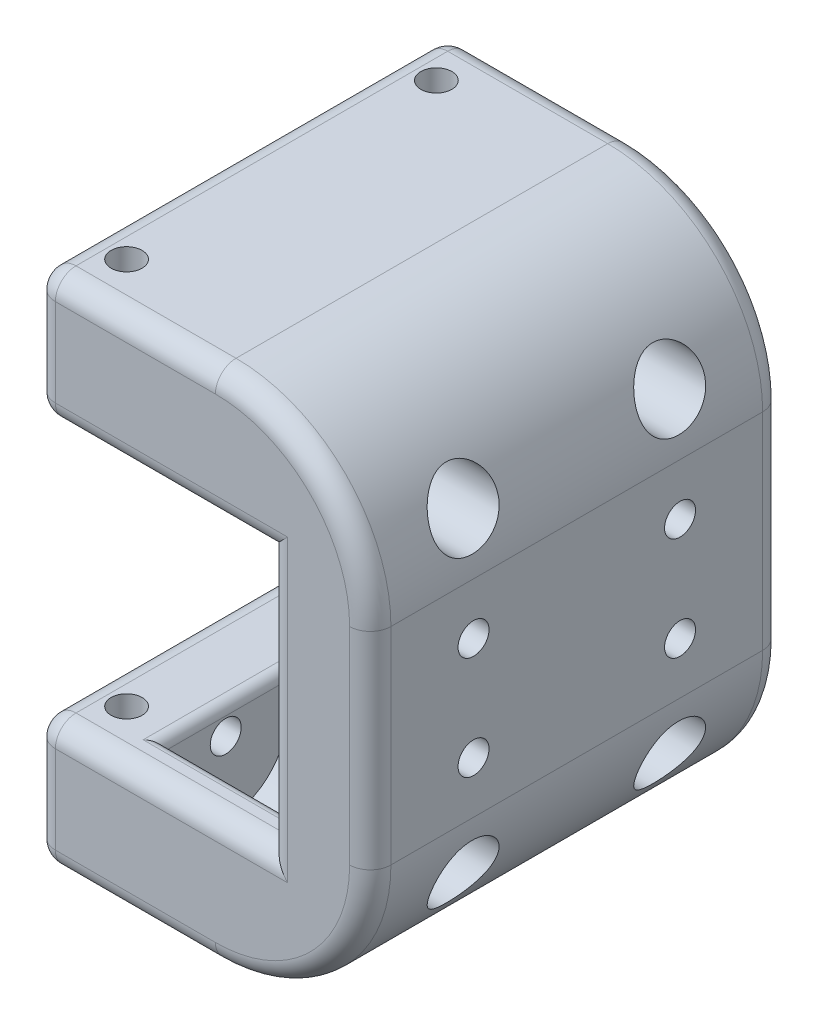
from build123d import *

# Parameters (mm, degrees)
BOSS_EXTRUDE1_DEPTH     = 50.8
SKETCH2_R               = 1.905
CUT_EXTRUDE1_DEPTH      = 92.194932014
CUT_EXTRUDE2_DEPTH      = 15.24
CUT_EXTRUDE3_START      = -92.194932014
SKETCH7_R               = 2.286
CUT_EXTRUDE3_DEPTH      = 107.434932014
CUT_EXTRUDE4_START      = -9.525
SKETCH8_R               = 4.1275
CUT_EXTRUDE4_DEPTH      = 101.719932014
SKETCH12_R              = 1.905
CUT_EXTRUDE8_DEPTH      = 9.525
SKETCH13_R              = 1.905
CUT_EXTRUDE9_DEPTH      = 9.525
SKETCH14_R              = 1.905
CUT_EXTRUDE10_DEPTH     = 10.795
MIRROR4_COPY_1_DEPTH    = 15.24
MIRROR4_START           = -92.194932014
MIRROR4_COPY_2_SKETCH_R = 2.286
MIRROR4_COPY_2_DEPTH    = 107.434932014
MIRROR4_START_2         = -9.525
MIRROR4_COPY_3_SKETCH_R = 4.1275
MIRROR4_COPY_3_DEPTH    = 101.719932014
MIRROR4_COPY_4_SKETCH_R = 1.905
MIRROR4_COPY_4_DEPTH    = 9.525
MIRROR4_COPY_5_SKETCH_R = 1.905
MIRROR4_COPY_5_DEPTH    = 9.525
MIRROR4_COPY_6_SKETCH_R = 1.905
MIRROR4_COPY_6_DEPTH    = 10.795
MIRROR4_COPY_7_SKETCH_R = 1.905
MIRROR4_COPY_7_DEPTH    = 9.525
FILLET3_DEPTH           = 50.8
FILLET4_R               = 2.54
FILLET5_R               = 1.27


with BuildPart() as part:
    # Sketch1 → Boss-Extrude1 (new body)
    with BuildSketch(Plane.XY):
        Polygon((0, 0), (0, 63.5), (-41.275, 63.5), (-41.275, 47.625), (-12.7, 47.625), (-12.7, 15.875), (-41.275, 15.875), (-41.275, 0), align=None)
    extrude(amount=BOSS_EXTRUDE1_DEPTH)

    # Sketch2 → Cut-Extrude1 (cut, through all)
    with BuildSketch(Plane(origin=(0, 63.5, 0), x_dir=(1, 0, 0), z_dir=(0, 1, 0))):
        with Locations(Location((-36.322, -44.45, 0), (0, 0, 180))):
            Circle(SKETCH2_R)
        with Locations(Location((-36.322, -6.35, 0), (0, 0, 180))):
            Circle(SKETCH2_R)
    extrude(amount=-CUT_EXTRUDE1_DEPTH, mode=Mode.SUBTRACT)

    # Sketch5 → Cut-Extrude2 (cut)
    with BuildSketch(Plane.ZY.offset(15.24)):
        with BuildLine():
            Line((5.08, 11.1125), (5.08, 15.875))
            Line((5.08, 15.875), (20.32, 15.875))
            Line((20.32, 15.875), (20.32, 11.1125))
            ThreePointArc((20.32, 11.1125), (12.7, 3.4925), (5.08, 11.1125))
        make_face()
    cut_extrude2 = extrude(amount=CUT_EXTRUDE2_DEPTH, mode=Mode.SUBTRACT)

    # Sketch7 → Cut-Extrude3 (cut)
    with BuildSketch(Plane.ZY.offset(CUT_EXTRUDE3_START)):
        with Locations(Location((12.7, 12.3825, 0), (0, 0, 180))):
            Circle(SKETCH7_R)
    cut_extrude3 = extrude(amount=CUT_EXTRUDE3_DEPTH, mode=Mode.SUBTRACT)

    # Sketch8 → Cut-Extrude4 (cut)
    with BuildSketch(Plane(origin=(0, 0, 0), x_dir=(0, 0, -1), z_dir=(1, 0, 0)).offset(CUT_EXTRUDE4_START)):
        with Locations(Location((-12.7, 12.3825, 0), (0, 0, 180))):
            Circle(SKETCH8_R)
    cut_extrude4 = extrude(amount=CUT_EXTRUDE4_DEPTH, mode=Mode.SUBTRACT)

    # Sketch12 → Cut-Extrude8 (cut)
    with BuildSketch(Plane(origin=(0, 0, 0), x_dir=(0, 0, -1), z_dir=(1, 0, 0))):
        with Locations((-12.7, 25.4)):
            Circle(SKETCH12_R)
    cut_extrude8 = extrude(amount=-CUT_EXTRUDE8_DEPTH, mode=Mode.SUBTRACT)

    # Sketch13 → Cut-Extrude9 (cut)
    with BuildSketch(Plane.ZY.offset(12.7)):
        with Locations((6.35, 31.75)):
            Circle(SKETCH13_R)
    cut_extrude9 = extrude(amount=-CUT_EXTRUDE9_DEPTH, mode=Mode.SUBTRACT)

    # Sketch14 → Cut-Extrude10 (cut)
    with BuildSketch(Plane.ZY.offset(41.275)):
        with Locations((12.7, 12.446)):
            Circle(SKETCH14_R)
    cut_extrude10 = extrude(amount=-CUT_EXTRUDE10_DEPTH, mode=Mode.SUBTRACT)

    # Mirror3: Cut-Extrude2, Cut-Extrude3, Cut-Extrude4, Cut-Extrude8, Cut-Extrude9, Cut-Extrude10 across plane
    add(cut_extrude2.mirror(Plane(origin=(0, 0, 25.4), x_dir=(1, 0, 0), z_dir=(0, 0, -1))), mode=Mode.SUBTRACT)
    add(cut_extrude3.mirror(Plane(origin=(0, 0, 25.4), x_dir=(1, 0, 0), z_dir=(0, 0, -1))), mode=Mode.SUBTRACT)
    add(cut_extrude4.mirror(Plane(origin=(0, 0, 25.4), x_dir=(1, 0, 0), z_dir=(0, 0, -1))), mode=Mode.SUBTRACT)
    add(cut_extrude8.mirror(Plane(origin=(0, 0, 25.4), x_dir=(1, 0, 0), z_dir=(0, 0, -1))), mode=Mode.SUBTRACT)
    add(cut_extrude9.mirror(Plane(origin=(0, 0, 25.4), x_dir=(1, 0, 0), z_dir=(0, 0, -1))), mode=Mode.SUBTRACT)
    add(cut_extrude10.mirror(Plane(origin=(0, 0, 25.4), x_dir=(1, 0, 0), z_dir=(0, 0, -1))), mode=Mode.SUBTRACT)

    # Mirror4: Cut-Extrude2, Cut-Extrude3, Cut-Extrude4, Cut-Extrude8, Cut-Extrude10 across plane
    add(cut_extrude2.mirror(Plane.ZX.offset(31.75)), mode=Mode.SUBTRACT)
    add(cut_extrude3.mirror(Plane.ZX.offset(31.75)), mode=Mode.SUBTRACT)
    add(cut_extrude4.mirror(Plane.ZX.offset(31.75)), mode=Mode.SUBTRACT)
    add(cut_extrude8.mirror(Plane.ZX.offset(31.75)), mode=Mode.SUBTRACT)
    add(cut_extrude10.mirror(Plane.ZX.offset(31.75)), mode=Mode.SUBTRACT)

    # Mirror4 copy 1 sketch → Mirror4 copy 1 (cut)
    with BuildSketch(Plane(origin=(-15.24, 63.5, 50.8), x_dir=(0, 0, -1), z_dir=(-1, 0, 0))):
        with BuildLine():
            Line((5.08, 11.1125), (5.08, 15.875))
            Line((5.08, 15.875), (20.32, 15.875))
            Line((20.32, 15.875), (20.32, 11.1125))
            ThreePointArc((20.32, 11.1125), (12.7, 3.4925), (5.08, 11.1125))
        make_face()
    extrude(amount=MIRROR4_COPY_1_DEPTH, mode=Mode.SUBTRACT)

    # Mirror4 copy 2 sketch → Mirror4 copy 2 (cut)
    with BuildSketch(Plane(origin=(0, 63.5, 50.8), x_dir=(0, 0, -1), z_dir=(-1, 0, 0)).offset(MIRROR4_START)):
        with Locations(Location((12.7, 12.3825, 0), (0, 0, 180))):
            Circle(MIRROR4_COPY_2_SKETCH_R)
    extrude(amount=MIRROR4_COPY_2_DEPTH, mode=Mode.SUBTRACT)

    # Mirror4 copy 3 sketch → Mirror4 copy 3 (cut)
    with BuildSketch(Plane(origin=(0, 63.5, 50.8), x_dir=(0, 0, 1), z_dir=(1, 0, 0)).offset(MIRROR4_START_2)):
        with Locations(Location((-12.7, 12.3825, 0), (0, 0, 180))):
            Circle(MIRROR4_COPY_3_SKETCH_R)
    extrude(amount=MIRROR4_COPY_3_DEPTH, mode=Mode.SUBTRACT)

    # Mirror4 copy 4 sketch → Mirror4 copy 4 (cut)
    with BuildSketch(Plane(origin=(0, 63.5, 50.8), x_dir=(0, 0, 1), z_dir=(1, 0, 0))):
        with Locations((-12.7, 25.4)):
            Circle(MIRROR4_COPY_4_SKETCH_R)
    extrude(amount=-MIRROR4_COPY_4_DEPTH, mode=Mode.SUBTRACT)

    # Mirror4 copy 5 sketch → Mirror4 copy 5 (cut)
    with BuildSketch(Plane(origin=(-12.7, 63.5, 50.8), x_dir=(0, 0, -1), z_dir=(-1, 0, 0))):
        with Locations((6.35, 31.75)):
            Circle(MIRROR4_COPY_5_SKETCH_R)
    extrude(amount=-MIRROR4_COPY_5_DEPTH, mode=Mode.SUBTRACT)

    # Mirror4 copy 6 sketch → Mirror4 copy 6 (cut)
    with BuildSketch(Plane(origin=(-41.275, 63.5, 50.8), x_dir=(0, 0, -1), z_dir=(-1, 0, 0))):
        with Locations((12.7, 12.446)):
            Circle(MIRROR4_COPY_6_SKETCH_R)
    extrude(amount=-MIRROR4_COPY_6_DEPTH, mode=Mode.SUBTRACT)

    # Mirror4 copy 7 sketch → Mirror4 copy 7 (cut)
    with BuildSketch(Plane(origin=(-12.7, 63.5, 0), x_dir=(0, 0, 1), z_dir=(-1, 0, 0))):
        with Locations((6.35, -31.75)):
            Circle(MIRROR4_COPY_7_SKETCH_R)
    extrude(amount=-MIRROR4_COPY_7_DEPTH, mode=Mode.SUBTRACT)

    # Fillet3: read off the stored shape, not the designer's step
    # Fillet3 outline → Fillet3 (cut)
    with BuildSketch(Plane.XY):
        with BuildLine():
            Line((0, 0), (0, 19.05))
            ThreePointArc((0, 19.05), (-5.579615818, 5.579615818), (-19.05, 0))
            Line((-19.05, 0), (0, 0))
        make_face()
        with BuildLine():
            ThreePointArc((-19.05, 63.5), (-5.579615818, 57.920384182), (0, 44.45))
            Line((0, 44.45), (0, 63.5))
            Line((0, 63.5), (-19.05, 63.5))
        make_face()
    extrude(amount=FILLET3_DEPTH, mode=Mode.SUBTRACT)

    # Fillet4
    # the kernel refuses this fillet: 2.54 mm, written as the material it takes off along each edge
    with BuildSketch(Plane(origin=(-38.735, 60.96, 2.54), x_dir=(-1, 0, 0), z_dir=(0, 0, -1))) as fillet4_piece_1_section:
        Polygon((0, 0), (FILLET4_R, 0), (FILLET4_R, FILLET4_R), (0, FILLET4_R), align=None)
    fillet4_piece_1 = extrude(amount=FILLET4_R, mode=Mode.PRIVATE)
    fillet4_piece_1 = fillet4_piece_1 - Plane(origin=(-38.735, 60.96, 2.54), x_dir=(0.7071067811865477, -0.7071067811865474, 0), z_dir=(0, 0, -1)) * Sphere(FILLET4_R, mode=Mode.PRIVATE)
    add(fillet4_piece_1, mode=Mode.SUBTRACT)
    with BuildSketch(Plane(origin=(-38.735, 50.165, 2.54), x_dir=(0, -1, 0), z_dir=(0, 0, -1))) as fillet4_piece_2_section:
        Polygon((0, 0), (FILLET4_R, 0), (FILLET4_R, FILLET4_R), (0, FILLET4_R), align=None)
    fillet4_piece_2 = extrude(amount=FILLET4_R, mode=Mode.PRIVATE)
    fillet4_piece_2 = fillet4_piece_2 - Plane(origin=(-38.735, 50.165, 2.54), x_dir=(0.7071067811865475, 0.7071067811865476, 0), z_dir=(0, 0, -1)) * Sphere(FILLET4_R, mode=Mode.PRIVATE)
    add(fillet4_piece_2, mode=Mode.SUBTRACT)
    with BuildSketch(Plane(origin=(-38.735, 2.54, 2.54), x_dir=(-1, 0, 0), z_dir=(0, 0, -1))) as fillet4_piece_3_section:
        Polygon((0, 0), (FILLET4_R, 0), (FILLET4_R, -FILLET4_R), (0, -FILLET4_R), align=None)
    fillet4_piece_3 = extrude(amount=FILLET4_R, mode=Mode.PRIVATE)
    fillet4_piece_3 = fillet4_piece_3 - Plane(origin=(-38.735, 2.54, 2.54), x_dir=(0.7071067811865475, 0.7071067811865475, 0), z_dir=(0, 0, -1)) * Sphere(FILLET4_R, mode=Mode.PRIVATE)
    add(fillet4_piece_3, mode=Mode.SUBTRACT)
    with BuildSketch(Plane(origin=(-38.735, 2.54, 48.26), x_dir=(-1, 0, 0), z_dir=(0, -1, 0))) as fillet4_piece_4_section:
        Polygon((0, 0), (FILLET4_R, 0), (FILLET4_R, -FILLET4_R), (0, -FILLET4_R), align=None)
    fillet4_piece_4 = extrude(amount=FILLET4_R, mode=Mode.PRIVATE)
    fillet4_piece_4 = fillet4_piece_4 - Plane(origin=(-38.735, 2.54, 48.26), x_dir=(0.7071067811865475, 0, -0.7071067811865475), z_dir=(0, -1, 0)) * Sphere(FILLET4_R, mode=Mode.PRIVATE)
    add(fillet4_piece_4, mode=Mode.SUBTRACT)
    with BuildSketch(Plane(origin=(-38.735, 13.335, 2.54), x_dir=(-1, 0, 0), z_dir=(0, 0, -1))) as fillet4_piece_5_section:
        Polygon((0, 0), (FILLET4_R, 0), (FILLET4_R, FILLET4_R), (0, FILLET4_R), align=None)
    fillet4_piece_5 = extrude(amount=FILLET4_R, mode=Mode.PRIVATE)
    fillet4_piece_5 = fillet4_piece_5 - Plane(origin=(-38.735, 13.335, 2.54), x_dir=(0.7071067811865477, -0.7071067811865475, 0), z_dir=(0, 0, -1)) * Sphere(FILLET4_R, mode=Mode.PRIVATE)
    add(fillet4_piece_5, mode=Mode.SUBTRACT)
    with BuildSketch(Plane(origin=(-38.735, 13.335, 48.26), x_dir=(-1, 0, 0), z_dir=(0, 0, 1))) as fillet4_piece_6_section:
        Polygon((0, 0), (FILLET4_R, 0), (FILLET4_R, -FILLET4_R), (0, -FILLET4_R), align=None)
    fillet4_piece_6 = extrude(amount=FILLET4_R, mode=Mode.PRIVATE)
    fillet4_piece_6 = fillet4_piece_6 - Plane(origin=(-38.735, 13.335, 48.26), x_dir=(0.7071067811865477, -0.7071067811865475, 0), z_dir=(0, 0, 1)) * Sphere(FILLET4_R, mode=Mode.PRIVATE)
    add(fillet4_piece_6, mode=Mode.SUBTRACT)
    with BuildSketch(Plane(origin=(-38.735, 50.165, 48.26), x_dir=(0, -1, 0), z_dir=(0, 0, 1))) as fillet4_piece_7_section:
        Polygon((0, 0), (FILLET4_R, 0), (FILLET4_R, -FILLET4_R), (0, -FILLET4_R), align=None)
    fillet4_piece_7 = extrude(amount=FILLET4_R, mode=Mode.PRIVATE)
    fillet4_piece_7 = fillet4_piece_7 - Plane(origin=(-38.735, 50.165, 48.26), x_dir=(0.7071067811865475, 0.7071067811865476, 0), z_dir=(0, 0, 1)) * Sphere(FILLET4_R, mode=Mode.PRIVATE)
    add(fillet4_piece_7, mode=Mode.SUBTRACT)
    with BuildSketch(Plane(origin=(-38.735, 60.96, 48.26), x_dir=(-1, 0, 0), z_dir=(0, 0, 1))) as fillet4_piece_8_section:
        Polygon((0, 0), (FILLET4_R, 0), (FILLET4_R, -FILLET4_R), (0, -FILLET4_R), align=None)
    fillet4_piece_8 = extrude(amount=FILLET4_R, mode=Mode.PRIVATE)
    fillet4_piece_8 = fillet4_piece_8 - Plane(origin=(-38.735, 60.96, 48.26), x_dir=(0.7071067811865477, -0.7071067811865474, 0), z_dir=(0, 0, 1)) * Sphere(FILLET4_R, mode=Mode.PRIVATE)
    add(fillet4_piece_8, mode=Mode.SUBTRACT)
    with BuildSketch(Plane(origin=(-41.275, 60.96, 0), x_dir=(1, 0, 0), z_dir=(0, -1, 0)), Plane(origin=(-41.275, 13.335, 0), x_dir=(1, 0, 0), z_dir=(0, -1, 0))) as fillet4_piece_9:
        with BuildLine():
            CenterArc((FILLET4_R, FILLET4_R), FILLET4_R, 180, 90)
            Line((0, FILLET4_R), (0, 0))
            Line((0, 0), (FILLET4_R, 0))
        make_face()
    extrude(amount=10.795, mode=Mode.SUBTRACT)
    with BuildSketch(Plane(origin=(-38.735, 0, 0), x_dir=(0, 1, 0), z_dir=(1, 0, 0)), Plane(origin=(-19.05, 63.5, 0), x_dir=(0, -1, 0), z_dir=(-1, 0, 0))) as fillet4_piece_10:
        with BuildLine():
            CenterArc((FILLET4_R, FILLET4_R), FILLET4_R, 180, 90)
            Line((0, FILLET4_R), (0, 0))
            Line((0, 0), (FILLET4_R, 0))
        make_face()
    extrude(amount=19.685, mode=Mode.SUBTRACT)
    with BuildSketch(Plane(origin=(-41.275, 0, 2.54), x_dir=(1, 0, 0), z_dir=(0, 0, 1)), Plane(origin=(-41.275, 15.875, 2.54), x_dir=(0, -1, 0), z_dir=(0, 0, 1)), Plane(origin=(-41.275, 47.625, 2.54), x_dir=(1, 0, 0), z_dir=(0, 0, 1)), Plane(origin=(-41.275, 63.5, 2.54), x_dir=(0, -1, 0), z_dir=(0, 0, 1))) as fillet4_piece_11:
        with BuildLine():
            CenterArc((FILLET4_R, FILLET4_R), FILLET4_R, 180, 90)
            Line((0, FILLET4_R), (0, 0))
            Line((0, 0), (FILLET4_R, 0))
        make_face()
    extrude(amount=45.72, mode=Mode.SUBTRACT)
    with BuildSketch(Plane(origin=(-41.275, 60.96, 50.8), x_dir=(1, 0, 0), z_dir=(0, -1, 0)), Plane(origin=(-41.275, 13.335, 50.8), x_dir=(1, 0, 0), z_dir=(0, -1, 0))) as fillet4_piece_12:
        with BuildLine():
            CenterArc((FILLET4_R, -FILLET4_R), FILLET4_R, 90, 90)
            Line((0, -FILLET4_R), (0, 0))
            Line((0, 0), (FILLET4_R, 0))
        make_face()
    extrude(amount=10.795, mode=Mode.SUBTRACT)
    with BuildSketch(Plane(origin=(0, 19.05, 0), x_dir=(0, 0, 1), z_dir=(0, 1, 0))) as fillet4_piece_13:
        with BuildLine():
            CenterArc((FILLET4_R, -FILLET4_R), FILLET4_R, 90, 90)
            Line((0, -FILLET4_R), (0, 0))
            Line((0, 0), (FILLET4_R, 0))
        make_face()
    extrude(amount=25.4, mode=Mode.SUBTRACT)
    with BuildSketch(Plane(origin=(0, 19.05, 50.8), x_dir=(0, 0, -1), z_dir=(0, 1, 0))) as fillet4_piece_14:
        with BuildLine():
            CenterArc((FILLET4_R, FILLET4_R), FILLET4_R, 180, 90)
            Line((0, FILLET4_R), (0, 0))
            Line((0, 0), (FILLET4_R, 0))
        make_face()
    extrude(amount=25.4, mode=Mode.SUBTRACT)
    with BuildSketch(Plane(origin=(-19.049999999, 44.450000001, 0), x_dir=(-7.1021264115377e-11, 1.0, 0), z_dir=(-1.0, -7.1021264115377e-11, 0))) as fillet4_piece_15:
        with BuildLine():
            CenterArc((19.049999999 - FILLET4_R, -FILLET4_R), FILLET4_R, 0, 90)
            Line((19.049999999, -FILLET4_R), (19.049999999, 0))
            Line((19.049999999, 0), (19.049999999 - FILLET4_R, 0))
        make_face()
    revolve(axis=Axis((-19.049999999, 44.450000001, 0), (0, 0, -1)), revolution_arc=90.000000008, mode=Mode.SUBTRACT)
    with BuildSketch(Plane(origin=(-19.049999999, 19.049999999, 0), x_dir=(1.0, 7.1021264115377e-11, 0), z_dir=(-7.1021264115377e-11, 1.0, 0))) as fillet4_piece_16:
        with BuildLine():
            CenterArc((19.049999999 - FILLET4_R, -FILLET4_R), FILLET4_R, 0, 90)
            Line((19.049999999, -FILLET4_R), (19.049999999, 0))
            Line((19.049999999, 0), (19.049999999 - FILLET4_R, 0))
        make_face()
    revolve(axis=Axis((-19.049999999, 19.049999999, 0), (0, 0, -1)), revolution_arc=90.000000008, mode=Mode.SUBTRACT)
    with BuildSketch(Plane(origin=(-19.05, 63.5, 50.8), x_dir=(0, -1, 0), z_dir=(-1, 0, 0)), Plane(origin=(-38.735, 0, 50.8), x_dir=(0, 1, 0), z_dir=(1, 0, 0))) as fillet4_piece_17:
        with BuildLine():
            CenterArc((FILLET4_R, -FILLET4_R), FILLET4_R, 90, 90)
            Line((0, -FILLET4_R), (0, 0))
            Line((0, 0), (FILLET4_R, 0))
        make_face()
    extrude(amount=19.685, mode=Mode.SUBTRACT)
    with BuildSketch(Plane(origin=(-19.049999999, 44.450000001, 50.8), x_dir=(-7.1021264115377e-11, 1.0, 0), z_dir=(-1.0, -7.1021264115377e-11, 0))) as fillet4_piece_18:
        with BuildLine():
            CenterArc((19.049999999 - FILLET4_R, FILLET4_R), FILLET4_R, 270, 90)
            Line((19.049999999 - FILLET4_R, 0), (19.049999999, 0))
            Line((19.049999999, 0), (19.049999999, FILLET4_R))
        make_face()
    revolve(axis=Axis((-19.049999999, 44.450000001, 50.8), (0, 0, -1)), revolution_arc=90.000000008, mode=Mode.SUBTRACT)
    with BuildSketch(Plane(origin=(-19.049999999, 19.049999999, 50.8), x_dir=(1.0, 7.1021264115377e-11, 0), z_dir=(-7.1021264115377e-11, 1.0, 0))) as fillet4_piece_19:
        with BuildLine():
            CenterArc((19.049999999 - FILLET4_R, FILLET4_R), FILLET4_R, 270, 90)
            Line((19.049999999, FILLET4_R), (19.049999999, 0))
            Line((19.049999999, 0), (19.049999999 - FILLET4_R, 0))
        make_face()
    revolve(axis=Axis((-19.049999999, 19.049999999, 50.8), (0, 0, -1)), revolution_arc=90.000000008, mode=Mode.SUBTRACT)
    with BuildSketch(Plane(origin=(-38.735, 47.625, 50.8), x_dir=(0, 1, 0), z_dir=(1, 0, 0)), Plane(origin=(-12.7, 15.875, 50.8), x_dir=(0, -1, 0), z_dir=(-1, 0, 0))) as fillet4_piece_20:
        with BuildLine():
            CenterArc((FILLET4_R, -FILLET4_R), FILLET4_R, 90, 90)
            Line((0, -FILLET4_R), (0, 0))
            Line((0, 0), (FILLET4_R, 0))
        make_face()
    extrude(amount=26.035, mode=Mode.SUBTRACT)
    with BuildSketch(Plane(origin=(-12.7, 47.625, 50.8), x_dir=(1, 0, 0), z_dir=(0, -1, 0))) as fillet4_piece_21:
        with BuildLine():
            CenterArc((FILLET4_R, -FILLET4_R), FILLET4_R, 90, 90)
            Line((0, -FILLET4_R), (0, 0))
            Line((0, 0), (FILLET4_R, 0))
        make_face()
    extrude(amount=31.75, mode=Mode.SUBTRACT)
    with BuildSketch(Plane(origin=(-12.7, 15.875, 0), x_dir=(0, -1, 0), z_dir=(-1, 0, 0)), Plane(origin=(-38.735, 47.625, 0), x_dir=(0, 1, 0), z_dir=(1, 0, 0))) as fillet4_piece_22:
        with BuildLine():
            CenterArc((FILLET4_R, FILLET4_R), FILLET4_R, 180, 90)
            Line((0, FILLET4_R), (0, 0))
            Line((0, 0), (FILLET4_R, 0))
        make_face()
    extrude(amount=26.035, mode=Mode.SUBTRACT)
    with BuildSketch(Plane(origin=(-12.7, 47.625, 0), x_dir=(1, 0, 0), z_dir=(0, -1, 0))) as fillet4_piece_23:
        with BuildLine():
            CenterArc((FILLET4_R, FILLET4_R), FILLET4_R, 180, 90)
            Line((0, FILLET4_R), (0, 0))
            Line((0, 0), (FILLET4_R, 0))
        make_face()
    extrude(amount=31.75, mode=Mode.SUBTRACT)
    with BuildSketch(Plane(origin=(-12.7, 53.975, 50.8), x_dir=(1, 0, 0), z_dir=(0, -1, 0))) as fillet4_piece_24a_section:
        with BuildLine():
            CenterArc((FILLET4_R, -FILLET4_R), FILLET4_R, 90, 90)
            Line((0, -FILLET4_R), (0, 0))
            Line((0, 0), (FILLET4_R, 0))
        make_face()
    fillet4_piece_24a = extrude(amount=38.1, mode=Mode.PRIVATE)
    fillet4_piece_24a = split(fillet4_piece_24a, bisect_by=Plane(origin=(-12.7, 47.625, 50.8), z_dir=(0, 1, 0)), keep=Keep.TOP, mode=Mode.PRIVATE)
    with BuildSketch(Plane(origin=(-38.735, 47.625, 50.8), x_dir=(0, 1, 0), z_dir=(1, 0, 0))) as fillet4_piece_24b_section:
        with BuildLine():
            CenterArc((FILLET4_R, -FILLET4_R), FILLET4_R, 90, 90)
            Line((0, -FILLET4_R), (0, 0))
            Line((0, 0), (FILLET4_R, 0))
        make_face()
    fillet4_piece_24b = extrude(amount=32.385, mode=Mode.PRIVATE)
    fillet4_piece_24b = split(fillet4_piece_24b, bisect_by=Plane(origin=(-12.7, 47.625, 50.8), z_dir=(1, 0, 0)), keep=Keep.TOP, mode=Mode.PRIVATE)
    fillet4_piece_24 = fillet4_piece_24a & fillet4_piece_24b
    add(fillet4_piece_24, mode=Mode.SUBTRACT)
    with BuildSketch(Plane(origin=(-6.35, 15.875, 50.8), x_dir=(0, -1, 0), z_dir=(-1, 0, 0))) as fillet4_piece_25a_section:
        with BuildLine():
            CenterArc((FILLET4_R, -FILLET4_R), FILLET4_R, 90, 90)
            Line((0, -FILLET4_R), (0, 0))
            Line((0, 0), (FILLET4_R, 0))
        make_face()
    fillet4_piece_25a = extrude(amount=32.385, mode=Mode.PRIVATE)
    fillet4_piece_25a = split(fillet4_piece_25a, bisect_by=Plane(origin=(-12.7, 15.875, 50.8), z_dir=(1, 0, 0)), keep=Keep.TOP, mode=Mode.PRIVATE)
    with BuildSketch(Plane(origin=(-12.7, 47.625, 50.8), x_dir=(1, 0, 0), z_dir=(0, -1, 0))) as fillet4_piece_25b_section:
        with BuildLine():
            CenterArc((FILLET4_R, -FILLET4_R), FILLET4_R, 90, 90)
            Line((0, -FILLET4_R), (0, 0))
            Line((0, 0), (FILLET4_R, 0))
        make_face()
    fillet4_piece_25b = extrude(amount=38.1, mode=Mode.PRIVATE)
    fillet4_piece_25b = split(fillet4_piece_25b, bisect_by=Plane(origin=(-12.7, 15.875, 50.8), z_dir=(0, -1, 0)), keep=Keep.TOP, mode=Mode.PRIVATE)
    fillet4_piece_25 = fillet4_piece_25a & fillet4_piece_25b
    add(fillet4_piece_25, mode=Mode.SUBTRACT)
    with BuildSketch(Plane(origin=(-6.35, 15.875, 0), x_dir=(0, -1, 0), z_dir=(-1, 0, 0))) as fillet4_piece_26a_section:
        with BuildLine():
            CenterArc((FILLET4_R, FILLET4_R), FILLET4_R, 180, 90)
            Line((0, FILLET4_R), (0, 0))
            Line((0, 0), (FILLET4_R, 0))
        make_face()
    fillet4_piece_26a = extrude(amount=32.385, mode=Mode.PRIVATE)
    fillet4_piece_26a = split(fillet4_piece_26a, bisect_by=Plane(origin=(-12.7, 15.875, 0), z_dir=(1, 0, 0)), keep=Keep.TOP, mode=Mode.PRIVATE)
    with BuildSketch(Plane(origin=(-12.7, 47.625, 0), x_dir=(1, 0, 0), z_dir=(0, -1, 0))) as fillet4_piece_26b_section:
        with BuildLine():
            CenterArc((FILLET4_R, FILLET4_R), FILLET4_R, 180, 90)
            Line((0, FILLET4_R), (0, 0))
            Line((0, 0), (FILLET4_R, 0))
        make_face()
    fillet4_piece_26b = extrude(amount=38.1, mode=Mode.PRIVATE)
    fillet4_piece_26b = split(fillet4_piece_26b, bisect_by=Plane(origin=(-12.7, 15.875, 0), z_dir=(0, -1, 0)), keep=Keep.TOP, mode=Mode.PRIVATE)
    fillet4_piece_26 = fillet4_piece_26a & fillet4_piece_26b
    add(fillet4_piece_26, mode=Mode.SUBTRACT)
    with BuildSketch(Plane(origin=(-12.7, 53.975, 0), x_dir=(1, 0, 0), z_dir=(0, -1, 0))) as fillet4_piece_27a_section:
        with BuildLine():
            CenterArc((FILLET4_R, FILLET4_R), FILLET4_R, 180, 90)
            Line((0, FILLET4_R), (0, 0))
            Line((0, 0), (FILLET4_R, 0))
        make_face()
    fillet4_piece_27a = extrude(amount=38.1, mode=Mode.PRIVATE)
    fillet4_piece_27a = split(fillet4_piece_27a, bisect_by=Plane(origin=(-12.7, 47.625, 0), z_dir=(0, 1, 0)), keep=Keep.TOP, mode=Mode.PRIVATE)
    with BuildSketch(Plane(origin=(-38.735, 47.625, 0), x_dir=(0, 1, 0), z_dir=(1, 0, 0))) as fillet4_piece_27b_section:
        with BuildLine():
            CenterArc((FILLET4_R, FILLET4_R), FILLET4_R, 180, 90)
            Line((0, FILLET4_R), (0, 0))
            Line((0, 0), (FILLET4_R, 0))
        make_face()
    fillet4_piece_27b = extrude(amount=32.385, mode=Mode.PRIVATE)
    fillet4_piece_27b = split(fillet4_piece_27b, bisect_by=Plane(origin=(-12.7, 47.625, 0), z_dir=(1, 0, 0)), keep=Keep.TOP, mode=Mode.PRIVATE)
    fillet4_piece_27 = fillet4_piece_27a & fillet4_piece_27b
    add(fillet4_piece_27, mode=Mode.SUBTRACT)

    # Fillet5
    # the kernel refuses this fillet: 1.27 mm, written as the material it takes off along each edge
    with BuildSketch(Plane(origin=(-15.24, 47.625, 45.72), x_dir=(0, 1, 0), z_dir=(0, 0, -1)), Plane(origin=(-15.24, 47.625, 30.48), x_dir=(0, 1, 0), z_dir=(-1, 0, 0)), Plane(origin=(-30.48, 47.625, 5.08), x_dir=(0, 1, 0), z_dir=(0, 0, 1)), Plane(origin=(-15.24, 15.875, 5.08), x_dir=(0, -1, 0), z_dir=(0, 0, 1)), Plane(origin=(-15.24, 15.875, 20.32), x_dir=(0, -1, 0), z_dir=(-1, 0, 0)), Plane(origin=(-15.24, 15.875, 5.08), x_dir=(0, 0, -1), z_dir=(-1, 0, 0)), Plane(origin=(-30.48, 15.875, 45.72), x_dir=(0, -1, 0), z_dir=(0, 0, -1)), Plane(origin=(-15.24, 15.875, 45.72), x_dir=(0, -1, 0), z_dir=(-1, 0, 0))) as fillet5_piece_1:
        with BuildLine():
            CenterArc((FILLET5_R, FILLET5_R), FILLET5_R, 180, 90)
            Line((0, FILLET5_R), (0, 0))
            Line((0, 0), (FILLET5_R, 0))
        make_face()
    extrude(amount=15.24, mode=Mode.SUBTRACT)
    with BuildSketch(Plane(origin=(-15.24, 47.625, 45.72), x_dir=(0, 1, 0), z_dir=(-1, 0, 0)), Plane(origin=(-30.48, 47.625, 45.72), x_dir=(0, 1, 0), z_dir=(0, 0, -1)), Plane(origin=(-15.24, 47.625, 20.32), x_dir=(0, 1, 0), z_dir=(-1, 0, 0)), Plane(origin=(-15.24, 47.625, 5.08), x_dir=(0, 0, -1), z_dir=(-1, 0, 0)), Plane(origin=(-15.24, 47.625, 5.08), x_dir=(0, 1, 0), z_dir=(0, 0, 1)), Plane(origin=(-30.48, 15.875, 5.08), x_dir=(0, -1, 0), z_dir=(0, 0, 1)), Plane(origin=(-15.24, 15.875, 30.48), x_dir=(0, -1, 0), z_dir=(-1, 0, 0)), Plane(origin=(-15.24, 15.875, 45.72), x_dir=(0, -1, 0), z_dir=(0, 0, -1))) as fillet5_piece_2:
        with BuildLine():
            CenterArc((FILLET5_R, -FILLET5_R), FILLET5_R, 90, 90)
            Line((0, -FILLET5_R), (0, 0))
            Line((0, 0), (FILLET5_R, 0))
        make_face()
    extrude(amount=15.24, mode=Mode.SUBTRACT)
    with BuildSketch(Plane(origin=(-15.24, 47.625, 48.895), x_dir=(0, 1, 0), z_dir=(0, 0, -1))) as fillet5_piece_3a_section:
        with BuildLine():
            CenterArc((FILLET5_R, FILLET5_R), FILLET5_R, 180, 90)
            Line((0, FILLET5_R), (0, 0))
            Line((0, 0), (FILLET5_R, 0))
        make_face()
    fillet5_piece_3a = extrude(amount=18.415, mode=Mode.PRIVATE)
    fillet5_piece_3a = split(fillet5_piece_3a, bisect_by=Plane(origin=(-15.24, 47.625, 45.72), z_dir=(0, 0, 1)), keep=Keep.TOP, mode=Mode.PRIVATE)
    with BuildSketch(Plane(origin=(-12.065, 47.625, 45.72), x_dir=(0, 1, 0), z_dir=(-1, 0, 0))) as fillet5_piece_3b_section:
        with BuildLine():
            CenterArc((FILLET5_R, -FILLET5_R), FILLET5_R, 90, 90)
            Line((0, -FILLET5_R), (0, 0))
            Line((0, 0), (FILLET5_R, 0))
        make_face()
    fillet5_piece_3b = extrude(amount=18.415, mode=Mode.PRIVATE)
    fillet5_piece_3b = split(fillet5_piece_3b, bisect_by=Plane(origin=(-15.24, 47.625, 45.72), z_dir=(1, 0, 0)), keep=Keep.TOP, mode=Mode.PRIVATE)
    fillet5_piece_3b = split(fillet5_piece_3b, bisect_by=Plane(origin=(-12.7, 47.625, 45.72), z_dir=(-1, 0, 0)), keep=Keep.TOP, mode=Mode.PRIVATE)
    fillet5_piece_3 = fillet5_piece_3a & fillet5_piece_3b
    add(fillet5_piece_3, mode=Mode.SUBTRACT)
    with BuildSketch(Plane(origin=(-12.065, 47.625, 30.48), x_dir=(0, 1, 0), z_dir=(-1, 0, 0))) as fillet5_piece_4a_section:
        with BuildLine():
            CenterArc((FILLET5_R, FILLET5_R), FILLET5_R, 180, 90)
            Line((0, FILLET5_R), (0, 0))
            Line((0, 0), (FILLET5_R, 0))
        make_face()
    fillet5_piece_4a = extrude(amount=18.415, mode=Mode.PRIVATE)
    fillet5_piece_4a = split(fillet5_piece_4a, bisect_by=Plane(origin=(-15.24, 47.625, 30.48), z_dir=(1, 0, 0)), keep=Keep.TOP, mode=Mode.PRIVATE)
    fillet5_piece_4a = split(fillet5_piece_4a, bisect_by=Plane(origin=(-12.7, 47.625, 30.48), z_dir=(-1, 0, 0)), keep=Keep.TOP, mode=Mode.PRIVATE)
    with BuildSketch(Plane(origin=(-15.24, 47.625, 45.72), x_dir=(0, 1, 0), z_dir=(0, 0, -1))) as fillet5_piece_4b_section:
        with BuildLine():
            CenterArc((FILLET5_R, FILLET5_R), FILLET5_R, 180, 90)
            Line((0, FILLET5_R), (0, 0))
            Line((0, 0), (FILLET5_R, 0))
        make_face()
    fillet5_piece_4b = extrude(amount=18.415, mode=Mode.PRIVATE)
    fillet5_piece_4b = split(fillet5_piece_4b, bisect_by=Plane(origin=(-15.24, 47.625, 30.48), z_dir=(0, 0, -1)), keep=Keep.TOP, mode=Mode.PRIVATE)
    fillet5_piece_4 = fillet5_piece_4a & fillet5_piece_4b
    add(fillet5_piece_4, mode=Mode.SUBTRACT)
    with BuildSketch(Plane(origin=(-30.48, 47.625, 45.72), x_dir=(0, 1, 0), z_dir=(0, 0, -1))) as fillet5_piece_5a_section:
        with BuildLine():
            CenterArc((FILLET5_R, -FILLET5_R), FILLET5_R, 90, 90)
            Line((0, -FILLET5_R), (0, 0))
            Line((0, 0), (FILLET5_R, 0))
        make_face()
    fillet5_piece_5a = extrude(amount=18.415, mode=Mode.PRIVATE)
    fillet5_piece_5a = split(fillet5_piece_5a, bisect_by=Plane(origin=(-30.48, 47.625, 30.48), z_dir=(0, 0, -1)), keep=Keep.TOP, mode=Mode.PRIVATE)
    with BuildSketch(Plane(origin=(-15.24, 47.625, 30.48), x_dir=(0, 1, 0), z_dir=(-1, 0, 0))) as fillet5_piece_5b_section:
        with BuildLine():
            CenterArc((FILLET5_R, FILLET5_R), FILLET5_R, 180, 90)
            Line((0, FILLET5_R), (0, 0))
            Line((0, 0), (FILLET5_R, 0))
        make_face()
    fillet5_piece_5b = extrude(amount=18.415, mode=Mode.PRIVATE)
    fillet5_piece_5b = split(fillet5_piece_5b, bisect_by=Plane(origin=(-30.48, 47.625, 30.48), z_dir=(-1, 0, 0)), keep=Keep.TOP, mode=Mode.PRIVATE)
    fillet5_piece_5 = fillet5_piece_5a & fillet5_piece_5b
    add(fillet5_piece_5, mode=Mode.SUBTRACT)
    with BuildSketch(Plane(origin=(-30.48, 47.625, 48.895), x_dir=(0, 1, 0), z_dir=(0, 0, -1))) as fillet5_piece_6a_section:
        with BuildLine():
            CenterArc((FILLET5_R, -FILLET5_R), FILLET5_R, 90, 90)
            Line((0, -FILLET5_R), (0, 0))
            Line((0, 0), (FILLET5_R, 0))
        make_face()
    fillet5_piece_6a = extrude(amount=18.415, mode=Mode.PRIVATE)
    fillet5_piece_6a = split(fillet5_piece_6a, bisect_by=Plane(origin=(-30.48, 47.625, 45.72), z_dir=(0, 0, 1)), keep=Keep.TOP, mode=Mode.PRIVATE)
    with BuildSketch(Plane(origin=(-15.24, 47.625, 45.72), x_dir=(0, 1, 0), z_dir=(-1, 0, 0))) as fillet5_piece_6b_section:
        with BuildLine():
            CenterArc((FILLET5_R, -FILLET5_R), FILLET5_R, 90, 90)
            Line((0, -FILLET5_R), (0, 0))
            Line((0, 0), (FILLET5_R, 0))
        make_face()
    fillet5_piece_6b = extrude(amount=18.415, mode=Mode.PRIVATE)
    fillet5_piece_6b = split(fillet5_piece_6b, bisect_by=Plane(origin=(-30.48, 47.625, 45.72), z_dir=(-1, 0, 0)), keep=Keep.TOP, mode=Mode.PRIVATE)
    fillet5_piece_6 = fillet5_piece_6a & fillet5_piece_6b
    add(fillet5_piece_6, mode=Mode.SUBTRACT)
    with BuildSketch(Plane(origin=(-15.24, 47.625, 5.08), x_dir=(0, 1, 0), z_dir=(0, 0, 1))) as fillet5_piece_7a_section:
        with BuildLine():
            CenterArc((FILLET5_R, -FILLET5_R), FILLET5_R, 90, 90)
            Line((0, -FILLET5_R), (0, 0))
            Line((0, 0), (FILLET5_R, 0))
        make_face()
    fillet5_piece_7a = extrude(amount=18.415, mode=Mode.PRIVATE)
    fillet5_piece_7a = split(fillet5_piece_7a, bisect_by=Plane(origin=(-15.24, 47.625, 20.32), z_dir=(0, 0, 1)), keep=Keep.TOP, mode=Mode.PRIVATE)
    with BuildSketch(Plane(origin=(-12.065, 47.625, 20.32), x_dir=(0, 1, 0), z_dir=(-1, 0, 0))) as fillet5_piece_7b_section:
        with BuildLine():
            CenterArc((FILLET5_R, -FILLET5_R), FILLET5_R, 90, 90)
            Line((0, -FILLET5_R), (0, 0))
            Line((0, 0), (FILLET5_R, 0))
        make_face()
    fillet5_piece_7b = extrude(amount=18.415, mode=Mode.PRIVATE)
    fillet5_piece_7b = split(fillet5_piece_7b, bisect_by=Plane(origin=(-15.24, 47.625, 20.32), z_dir=(1, 0, 0)), keep=Keep.TOP, mode=Mode.PRIVATE)
    fillet5_piece_7b = split(fillet5_piece_7b, bisect_by=Plane(origin=(-12.7, 47.625, 20.32), z_dir=(-1, 0, 0)), keep=Keep.TOP, mode=Mode.PRIVATE)
    fillet5_piece_7 = fillet5_piece_7a & fillet5_piece_7b
    add(fillet5_piece_7, mode=Mode.SUBTRACT)
    with BuildSketch(Plane(origin=(-15.24, 47.625, 20.32), x_dir=(0, 1, 0), z_dir=(-1, 0, 0))) as fillet5_piece_8a_section:
        with BuildLine():
            CenterArc((FILLET5_R, -FILLET5_R), FILLET5_R, 90, 90)
            Line((0, -FILLET5_R), (0, 0))
            Line((0, 0), (FILLET5_R, 0))
        make_face()
    fillet5_piece_8a = extrude(amount=18.415, mode=Mode.PRIVATE)
    fillet5_piece_8a = split(fillet5_piece_8a, bisect_by=Plane(origin=(-30.48, 47.625, 20.32), z_dir=(-1, 0, 0)), keep=Keep.TOP, mode=Mode.PRIVATE)
    with BuildSketch(Plane(origin=(-30.48, 47.625, 5.08), x_dir=(0, 1, 0), z_dir=(0, 0, 1))) as fillet5_piece_8b_section:
        with BuildLine():
            CenterArc((FILLET5_R, FILLET5_R), FILLET5_R, 180, 90)
            Line((0, FILLET5_R), (0, 0))
            Line((0, 0), (FILLET5_R, 0))
        make_face()
    fillet5_piece_8b = extrude(amount=18.415, mode=Mode.PRIVATE)
    fillet5_piece_8b = split(fillet5_piece_8b, bisect_by=Plane(origin=(-30.48, 47.625, 20.32), z_dir=(0, 0, 1)), keep=Keep.TOP, mode=Mode.PRIVATE)
    fillet5_piece_8 = fillet5_piece_8a & fillet5_piece_8b
    add(fillet5_piece_8, mode=Mode.SUBTRACT)
    with BuildSketch(Plane(origin=(-30.48, 47.625, 1.905), x_dir=(0, 1, 0), z_dir=(0, 0, 1))) as fillet5_piece_9a_section:
        with BuildLine():
            CenterArc((FILLET5_R, FILLET5_R), FILLET5_R, 180, 90)
            Line((0, FILLET5_R), (0, 0))
            Line((0, 0), (FILLET5_R, 0))
        make_face()
    fillet5_piece_9a = extrude(amount=18.415, mode=Mode.PRIVATE)
    fillet5_piece_9a = split(fillet5_piece_9a, bisect_by=Plane(origin=(-30.48, 47.625, 5.08), z_dir=(0, 0, -1)), keep=Keep.TOP, mode=Mode.PRIVATE)
    with BuildSketch(Plane(origin=(-15.24, 47.625, 5.08), x_dir=(0, 0, -1), z_dir=(-1, 0, 0))) as fillet5_piece_9b_section:
        with BuildLine():
            CenterArc((FILLET5_R, -FILLET5_R), FILLET5_R, 90, 90)
            Line((0, -FILLET5_R), (0, 0))
            Line((0, 0), (FILLET5_R, 0))
        make_face()
    fillet5_piece_9b = extrude(amount=18.415, mode=Mode.PRIVATE)
    fillet5_piece_9b = split(fillet5_piece_9b, bisect_by=Plane(origin=(-30.48, 47.625, 5.08), z_dir=(-1, 0, 0)), keep=Keep.TOP, mode=Mode.PRIVATE)
    fillet5_piece_9 = fillet5_piece_9a & fillet5_piece_9b
    add(fillet5_piece_9, mode=Mode.SUBTRACT)
    with BuildSketch(Plane(origin=(-15.24, 47.625, 1.905), x_dir=(0, 1, 0), z_dir=(0, 0, 1))) as fillet5_piece_10a_section:
        with BuildLine():
            CenterArc((FILLET5_R, -FILLET5_R), FILLET5_R, 90, 90)
            Line((0, -FILLET5_R), (0, 0))
            Line((0, 0), (FILLET5_R, 0))
        make_face()
    fillet5_piece_10a = extrude(amount=18.415, mode=Mode.PRIVATE)
    fillet5_piece_10a = split(fillet5_piece_10a, bisect_by=Plane(origin=(-15.24, 47.625, 5.08), z_dir=(0, 0, -1)), keep=Keep.TOP, mode=Mode.PRIVATE)
    with BuildSketch(Plane(origin=(-12.065, 47.625, 5.08), x_dir=(0, 0, -1), z_dir=(-1, 0, 0))) as fillet5_piece_10b_section:
        with BuildLine():
            CenterArc((FILLET5_R, -FILLET5_R), FILLET5_R, 90, 90)
            Line((0, -FILLET5_R), (0, 0))
            Line((0, 0), (FILLET5_R, 0))
        make_face()
    fillet5_piece_10b = extrude(amount=18.415, mode=Mode.PRIVATE)
    fillet5_piece_10b = split(fillet5_piece_10b, bisect_by=Plane(origin=(-15.24, 47.625, 5.08), z_dir=(1, 0, 0)), keep=Keep.TOP, mode=Mode.PRIVATE)
    fillet5_piece_10b = split(fillet5_piece_10b, bisect_by=Plane(origin=(-12.7, 47.625, 5.08), z_dir=(-1, 0, 0)), keep=Keep.TOP, mode=Mode.PRIVATE)
    fillet5_piece_10 = fillet5_piece_10a & fillet5_piece_10b
    add(fillet5_piece_10, mode=Mode.SUBTRACT)
    with BuildSketch(Plane(origin=(-15.24, 15.875, 1.905), x_dir=(0, -1, 0), z_dir=(0, 0, 1))) as fillet5_piece_11a_section:
        with BuildLine():
            CenterArc((FILLET5_R, FILLET5_R), FILLET5_R, 180, 90)
            Line((0, FILLET5_R), (0, 0))
            Line((0, 0), (FILLET5_R, 0))
        make_face()
    fillet5_piece_11a = extrude(amount=18.415, mode=Mode.PRIVATE)
    fillet5_piece_11a = split(fillet5_piece_11a, bisect_by=Plane(origin=(-15.24, 15.875, 5.08), z_dir=(0, 0, -1)), keep=Keep.TOP, mode=Mode.PRIVATE)
    with BuildSketch(Plane(origin=(-12.065, 15.875, 5.08), x_dir=(0, 0, -1), z_dir=(-1, 0, 0))) as fillet5_piece_11b_section:
        with BuildLine():
            CenterArc((FILLET5_R, FILLET5_R), FILLET5_R, 180, 90)
            Line((0, FILLET5_R), (0, 0))
            Line((0, 0), (FILLET5_R, 0))
        make_face()
    fillet5_piece_11b = extrude(amount=18.415, mode=Mode.PRIVATE)
    fillet5_piece_11b = split(fillet5_piece_11b, bisect_by=Plane(origin=(-15.24, 15.875, 5.08), z_dir=(1, 0, 0)), keep=Keep.TOP, mode=Mode.PRIVATE)
    fillet5_piece_11b = split(fillet5_piece_11b, bisect_by=Plane(origin=(-12.7, 15.875, 5.08), z_dir=(-1, 0, 0)), keep=Keep.TOP, mode=Mode.PRIVATE)
    fillet5_piece_11 = fillet5_piece_11a & fillet5_piece_11b
    add(fillet5_piece_11, mode=Mode.SUBTRACT)
    with BuildSketch(Plane(origin=(-15.24, 15.875, 5.08), x_dir=(0, -1, 0), z_dir=(0, 0, 1))) as fillet5_piece_12a_section:
        with BuildLine():
            CenterArc((FILLET5_R, FILLET5_R), FILLET5_R, 180, 90)
            Line((0, FILLET5_R), (0, 0))
            Line((0, 0), (FILLET5_R, 0))
        make_face()
    fillet5_piece_12a = extrude(amount=18.415, mode=Mode.PRIVATE)
    fillet5_piece_12a = split(fillet5_piece_12a, bisect_by=Plane(origin=(-15.24, 15.875, 20.32), z_dir=(0, 0, 1)), keep=Keep.TOP, mode=Mode.PRIVATE)
    with BuildSketch(Plane(origin=(-12.065, 15.875, 20.32), x_dir=(0, -1, 0), z_dir=(-1, 0, 0))) as fillet5_piece_12b_section:
        with BuildLine():
            CenterArc((FILLET5_R, FILLET5_R), FILLET5_R, 180, 90)
            Line((0, FILLET5_R), (0, 0))
            Line((0, 0), (FILLET5_R, 0))
        make_face()
    fillet5_piece_12b = extrude(amount=18.415, mode=Mode.PRIVATE)
    fillet5_piece_12b = split(fillet5_piece_12b, bisect_by=Plane(origin=(-15.24, 15.875, 20.32), z_dir=(1, 0, 0)), keep=Keep.TOP, mode=Mode.PRIVATE)
    fillet5_piece_12b = split(fillet5_piece_12b, bisect_by=Plane(origin=(-12.7, 15.875, 20.32), z_dir=(-1, 0, 0)), keep=Keep.TOP, mode=Mode.PRIVATE)
    fillet5_piece_12 = fillet5_piece_12a & fillet5_piece_12b
    add(fillet5_piece_12, mode=Mode.SUBTRACT)
    with BuildSketch(Plane(origin=(-15.24, 15.875, 20.32), x_dir=(0, -1, 0), z_dir=(-1, 0, 0))) as fillet5_piece_13a_section:
        with BuildLine():
            CenterArc((FILLET5_R, FILLET5_R), FILLET5_R, 180, 90)
            Line((0, FILLET5_R), (0, 0))
            Line((0, 0), (FILLET5_R, 0))
        make_face()
    fillet5_piece_13a = extrude(amount=18.415, mode=Mode.PRIVATE)
    fillet5_piece_13a = split(fillet5_piece_13a, bisect_by=Plane(origin=(-30.48, 15.875, 20.32), z_dir=(-1, 0, 0)), keep=Keep.TOP, mode=Mode.PRIVATE)
    with BuildSketch(Plane(origin=(-30.48, 15.875, 5.08), x_dir=(0, -1, 0), z_dir=(0, 0, 1))) as fillet5_piece_13b_section:
        with BuildLine():
            CenterArc((FILLET5_R, -FILLET5_R), FILLET5_R, 90, 90)
            Line((0, -FILLET5_R), (0, 0))
            Line((0, 0), (FILLET5_R, 0))
        make_face()
    fillet5_piece_13b = extrude(amount=18.415, mode=Mode.PRIVATE)
    fillet5_piece_13b = split(fillet5_piece_13b, bisect_by=Plane(origin=(-30.48, 15.875, 20.32), z_dir=(0, 0, 1)), keep=Keep.TOP, mode=Mode.PRIVATE)
    fillet5_piece_13 = fillet5_piece_13a & fillet5_piece_13b
    add(fillet5_piece_13, mode=Mode.SUBTRACT)
    with BuildSketch(Plane(origin=(-30.48, 15.875, 1.905), x_dir=(0, -1, 0), z_dir=(0, 0, 1))) as fillet5_piece_14a_section:
        with BuildLine():
            CenterArc((FILLET5_R, -FILLET5_R), FILLET5_R, 90, 90)
            Line((0, -FILLET5_R), (0, 0))
            Line((0, 0), (FILLET5_R, 0))
        make_face()
    fillet5_piece_14a = extrude(amount=18.415, mode=Mode.PRIVATE)
    fillet5_piece_14a = split(fillet5_piece_14a, bisect_by=Plane(origin=(-30.48, 15.875, 5.08), z_dir=(0, 0, -1)), keep=Keep.TOP, mode=Mode.PRIVATE)
    with BuildSketch(Plane(origin=(-15.24, 15.875, 5.08), x_dir=(0, 0, -1), z_dir=(-1, 0, 0))) as fillet5_piece_14b_section:
        with BuildLine():
            CenterArc((FILLET5_R, FILLET5_R), FILLET5_R, 180, 90)
            Line((0, FILLET5_R), (0, 0))
            Line((0, 0), (FILLET5_R, 0))
        make_face()
    fillet5_piece_14b = extrude(amount=18.415, mode=Mode.PRIVATE)
    fillet5_piece_14b = split(fillet5_piece_14b, bisect_by=Plane(origin=(-30.48, 15.875, 5.08), z_dir=(-1, 0, 0)), keep=Keep.TOP, mode=Mode.PRIVATE)
    fillet5_piece_14 = fillet5_piece_14a & fillet5_piece_14b
    add(fillet5_piece_14, mode=Mode.SUBTRACT)
    with BuildSketch(Plane(origin=(-12.065, 15.875, 30.48), x_dir=(0, -1, 0), z_dir=(-1, 0, 0))) as fillet5_piece_15a_section:
        with BuildLine():
            CenterArc((FILLET5_R, -FILLET5_R), FILLET5_R, 90, 90)
            Line((0, -FILLET5_R), (0, 0))
            Line((0, 0), (FILLET5_R, 0))
        make_face()
    fillet5_piece_15a = extrude(amount=18.415, mode=Mode.PRIVATE)
    fillet5_piece_15a = split(fillet5_piece_15a, bisect_by=Plane(origin=(-12.7, 15.875, 30.48), z_dir=(-1, 0, 0)), keep=Keep.TOP, mode=Mode.PRIVATE)
    fillet5_piece_15a = split(fillet5_piece_15a, bisect_by=Plane(origin=(-15.24, 15.875, 30.48), z_dir=(1, 0, 0)), keep=Keep.TOP, mode=Mode.PRIVATE)
    with BuildSketch(Plane(origin=(-15.24, 15.875, 45.72), x_dir=(0, -1, 0), z_dir=(0, 0, -1))) as fillet5_piece_15b_section:
        with BuildLine():
            CenterArc((FILLET5_R, -FILLET5_R), FILLET5_R, 90, 90)
            Line((0, -FILLET5_R), (0, 0))
            Line((0, 0), (FILLET5_R, 0))
        make_face()
    fillet5_piece_15b = extrude(amount=18.415, mode=Mode.PRIVATE)
    fillet5_piece_15b = split(fillet5_piece_15b, bisect_by=Plane(origin=(-15.24, 15.875, 30.48), z_dir=(0, 0, -1)), keep=Keep.TOP, mode=Mode.PRIVATE)
    fillet5_piece_15 = fillet5_piece_15a & fillet5_piece_15b
    add(fillet5_piece_15, mode=Mode.SUBTRACT)
    with BuildSketch(Plane(origin=(-30.48, 15.875, 45.72), x_dir=(0, -1, 0), z_dir=(0, 0, -1))) as fillet5_piece_16a_section:
        with BuildLine():
            CenterArc((FILLET5_R, FILLET5_R), FILLET5_R, 180, 90)
            Line((0, FILLET5_R), (0, 0))
            Line((0, 0), (FILLET5_R, 0))
        make_face()
    fillet5_piece_16a = extrude(amount=18.415, mode=Mode.PRIVATE)
    fillet5_piece_16a = split(fillet5_piece_16a, bisect_by=Plane(origin=(-30.48, 15.875, 30.48), z_dir=(0, 0, -1)), keep=Keep.TOP, mode=Mode.PRIVATE)
    with BuildSketch(Plane(origin=(-15.24, 15.875, 30.48), x_dir=(0, -1, 0), z_dir=(-1, 0, 0))) as fillet5_piece_16b_section:
        with BuildLine():
            CenterArc((FILLET5_R, -FILLET5_R), FILLET5_R, 90, 90)
            Line((0, -FILLET5_R), (0, 0))
            Line((0, 0), (FILLET5_R, 0))
        make_face()
    fillet5_piece_16b = extrude(amount=18.415, mode=Mode.PRIVATE)
    fillet5_piece_16b = split(fillet5_piece_16b, bisect_by=Plane(origin=(-30.48, 15.875, 30.48), z_dir=(-1, 0, 0)), keep=Keep.TOP, mode=Mode.PRIVATE)
    fillet5_piece_16 = fillet5_piece_16a & fillet5_piece_16b
    add(fillet5_piece_16, mode=Mode.SUBTRACT)
    with BuildSketch(Plane(origin=(-30.48, 15.875, 48.895), x_dir=(0, -1, 0), z_dir=(0, 0, -1))) as fillet5_piece_17a_section:
        with BuildLine():
            CenterArc((FILLET5_R, FILLET5_R), FILLET5_R, 180, 90)
            Line((0, FILLET5_R), (0, 0))
            Line((0, 0), (FILLET5_R, 0))
        make_face()
    fillet5_piece_17a = extrude(amount=18.415, mode=Mode.PRIVATE)
    fillet5_piece_17a = split(fillet5_piece_17a, bisect_by=Plane(origin=(-30.48, 15.875, 45.72), z_dir=(0, 0, 1)), keep=Keep.TOP, mode=Mode.PRIVATE)
    with BuildSketch(Plane(origin=(-15.24, 15.875, 45.72), x_dir=(0, -1, 0), z_dir=(-1, 0, 0))) as fillet5_piece_17b_section:
        with BuildLine():
            CenterArc((FILLET5_R, FILLET5_R), FILLET5_R, 180, 90)
            Line((0, FILLET5_R), (0, 0))
            Line((0, 0), (FILLET5_R, 0))
        make_face()
    fillet5_piece_17b = extrude(amount=18.415, mode=Mode.PRIVATE)
    fillet5_piece_17b = split(fillet5_piece_17b, bisect_by=Plane(origin=(-30.48, 15.875, 45.72), z_dir=(-1, 0, 0)), keep=Keep.TOP, mode=Mode.PRIVATE)
    fillet5_piece_17 = fillet5_piece_17a & fillet5_piece_17b
    add(fillet5_piece_17, mode=Mode.SUBTRACT)
    with BuildSketch(Plane(origin=(-15.24, 15.875, 48.895), x_dir=(0, -1, 0), z_dir=(0, 0, -1))) as fillet5_piece_18a_section:
        with BuildLine():
            CenterArc((FILLET5_R, -FILLET5_R), FILLET5_R, 90, 90)
            Line((0, -FILLET5_R), (0, 0))
            Line((0, 0), (FILLET5_R, 0))
        make_face()
    fillet5_piece_18a = extrude(amount=18.415, mode=Mode.PRIVATE)
    fillet5_piece_18a = split(fillet5_piece_18a, bisect_by=Plane(origin=(-15.24, 15.875, 45.72), z_dir=(0, 0, 1)), keep=Keep.TOP, mode=Mode.PRIVATE)
    with BuildSketch(Plane(origin=(-12.065, 15.875, 45.72), x_dir=(0, -1, 0), z_dir=(-1, 0, 0))) as fillet5_piece_18b_section:
        with BuildLine():
            CenterArc((FILLET5_R, FILLET5_R), FILLET5_R, 180, 90)
            Line((0, FILLET5_R), (0, 0))
            Line((0, 0), (FILLET5_R, 0))
        make_face()
    fillet5_piece_18b = extrude(amount=18.415, mode=Mode.PRIVATE)
    fillet5_piece_18b = split(fillet5_piece_18b, bisect_by=Plane(origin=(-12.7, 15.875, 45.72), z_dir=(-1, 0, 0)), keep=Keep.TOP, mode=Mode.PRIVATE)
    fillet5_piece_18b = split(fillet5_piece_18b, bisect_by=Plane(origin=(-15.24, 15.875, 45.72), z_dir=(1, 0, 0)), keep=Keep.TOP, mode=Mode.PRIVATE)
    fillet5_piece_18 = fillet5_piece_18a & fillet5_piece_18b
    add(fillet5_piece_18, mode=Mode.SUBTRACT)


solid = part.part
